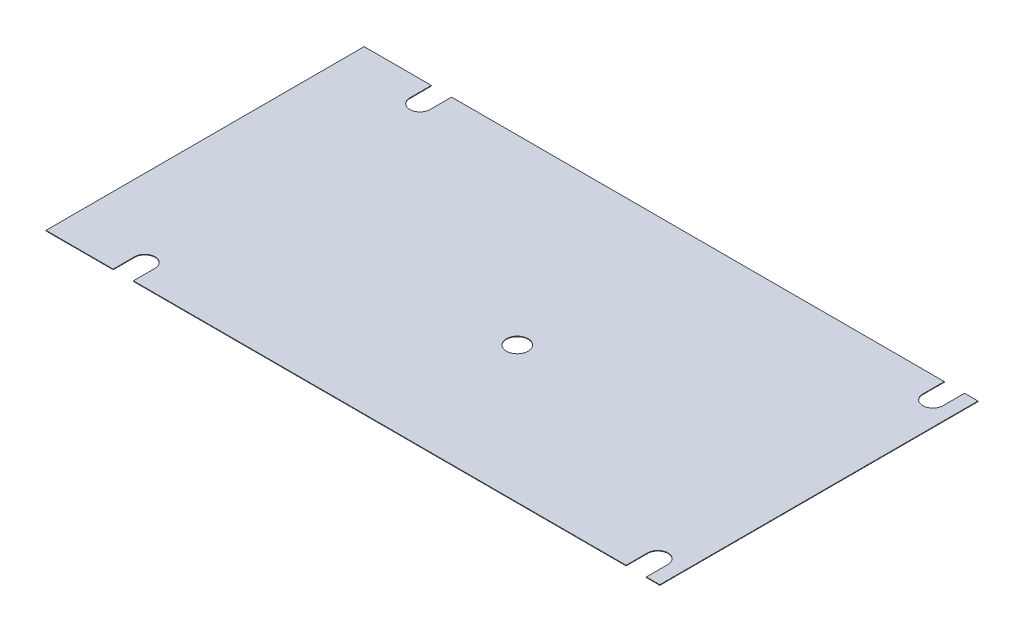
from build123d import *

# Parameters (mm, degrees)
STOCK_BOTTOM_START        = 1
STOCK_BOTTOM_CASE_1_DEPTH = 0.2
CUT_EXTRUDE1_DEPTH        = 120.620159254
CUT_EXTRUDE1_DEPTH_BACK   = 120.620159254
SKETCH1_R                 = 3.75


# Read off the part's stored shape, not the designer's step: Stock-Bottom case-1
with BuildPart() as part:
    # Stock-Bottom case-1 outline → Stock-Bottom case-1 (new body)
    with BuildSketch(Plane(origin=(0, 0, 0), x_dir=(1, 0, 0), z_dir=(0, 1, 0)).offset(STOCK_BOTTOM_START)):
        with BuildLine():
            Line((94.55, 55.05), (-75.95, 55.05))
            Line((-75.95, 55.05), (-75.95, 47.6))
            ThreePointArc((-75.95, 47.6), (-79.45, 44.1), (-82.95, 47.6))
            Line((-82.95, 47.6), (-82.95, 55.05))
            Line((-82.95, 55.05), (-106.2, 55.05))
            Line((-106.2, 55.05), (-106.2, -55.05))
            Line((-106.2, -55.05), (-82.95, -55.05))
            Line((-82.95, -55.05), (-82.95, -47.6))
            ThreePointArc((-82.95, -47.6), (-79.45, -44.1), (-75.95, -47.6))
            Line((-75.95, -47.6), (-75.95, -55.05))
            Line((-75.95, -55.05), (94.55, -55.05))
            Line((94.55, -55.05), (94.55, -47.6))
            ThreePointArc((94.55, -47.6), (98.05, -44.1), (101.55, -47.6))
            Line((101.55, -47.6), (101.55, -55.05))
            Line((101.55, -55.05), (106.2, -55.05))
            Line((106.2, -55.05), (106.2, 55.05))
            Line((106.2, 55.05), (101.55, 55.05))
            Line((101.55, 55.05), (101.55, 47.6))
            ThreePointArc((101.55, 47.6), (98.05, 44.1), (94.55, 47.6))
            Line((94.55, 47.6), (94.55, 55.05))
        make_face()
    extrude(amount=STOCK_BOTTOM_CASE_1_DEPTH)

    # Sketch1 → Cut-Extrude1 (cut, two sides: drawn at the far end of the back side and taken through both)
    with BuildSketch(Plane(origin=(0, 1.2, 0), x_dir=(1, 0, 0), z_dir=(0, 1, 0)).offset(-CUT_EXTRUDE1_DEPTH_BACK)):
        with Locations(Location((9.7, -7.85, 0), (0, 0, 270))):
            Circle(SKETCH1_R)
    extrude(amount=CUT_EXTRUDE1_DEPTH + CUT_EXTRUDE1_DEPTH_BACK, mode=Mode.SUBTRACT)


solid = part.part
